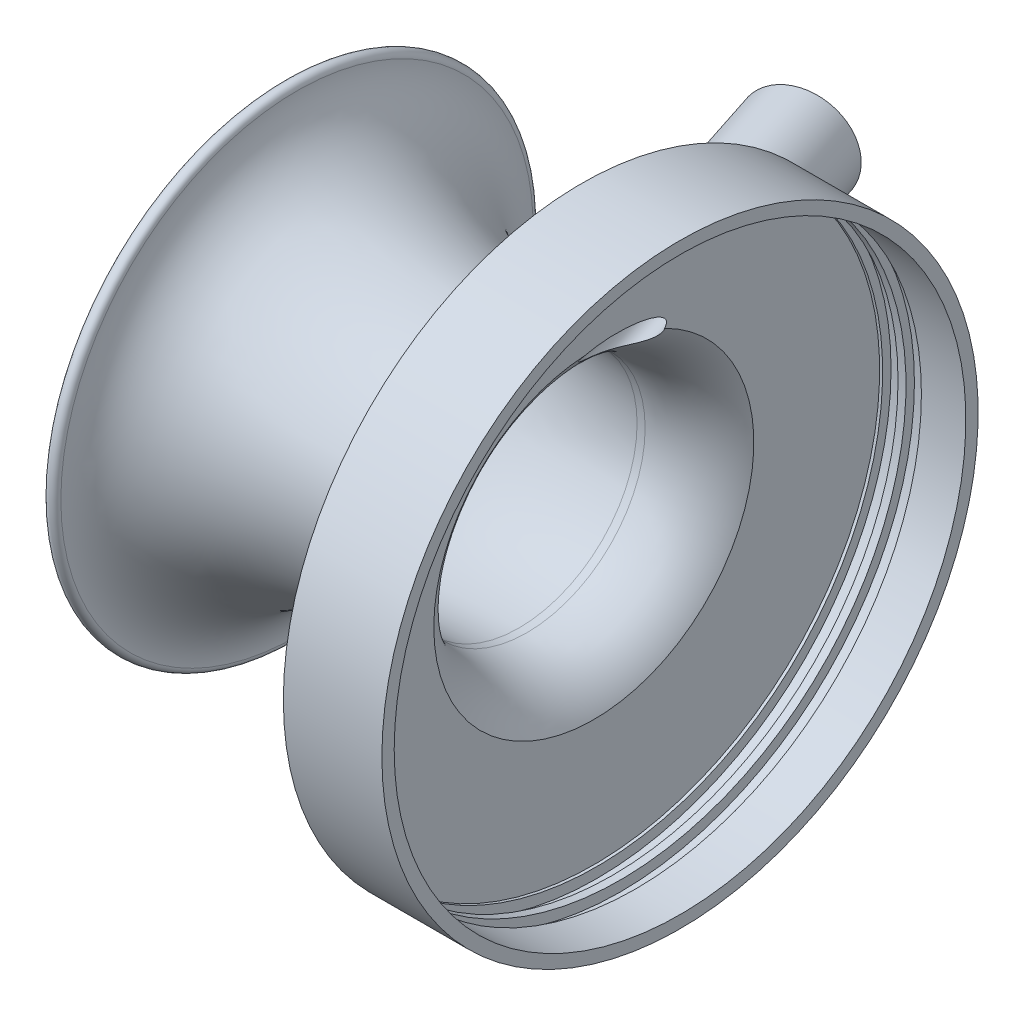
from build123d import *

# Parameters (mm, degrees)
BOSS_EXTRUDE1_REACH      = 139.829
SKETCH2_R                = 5.55625
SKETCH2_R_2              = 3.175
CUT_EXTRUDE1_DEPTH       = 138.828738616
CUT_EXTRUDE1_DEPTH_BACK  = 40.64
SKETCH2_3_R              = 3.175
BOSS_EXTRUDE3_DEPTH      = 25.4
BOSS_EXTRUDE3_DEPTH_BACK = 1.016
SKETCH2_4_R              = 10.16
SKETCH2_4_R_2            = 5.55625
SKETCH5_W                = 3.175
SKETCH5_H                = 2.8575


with BuildPart() as part:
    # Sketch1 → Revolve1 (revolve)
    with BuildSketch(Plane.XY):
        with BuildLine():
            Line((-17.78, 33.403326565), (-17.78, 59.350315565))
            Line((-17.78, 59.350315565), (0, 59.350315565))
            Line((0, 59.350315565), (0, 61.890315565))
            Line((0, 61.890315565), (-20.32, 61.890315565))
            Line((-20.32, 61.890315565), (-20.32, 34.099917601))
            ThreePointArc((-20.32, 34.099917601), (-25.180755406, 29.340296974), (-31.679989745, 27.330101799))
            Line((-31.679989745, 27.330101799), (-33.2365138, 27.301858752))
            add(Edge.make_bspline(
                [(-78.987624158, 49.101480512), (-78.987360194, 48.465111349), (-78.864304013, 47.206846617), (-78.115388687, 44.647319746), (-76.172826927, 41.382782544), (-72.124745626, 37.542839726), (-66.466655311, 34.059492548), (-59.433052835, 31.146010824), (-51.317519817, 28.959245462), (-42.474533701, 27.605945243), (-36.295988449, 27.30132344), (-33.2365138, 27.301858752)],
                knots=[3.141592654, 3.141592654, 3.141592654, 3.141592654, 3.239737699, 3.337882745, 3.534172837, 3.730462929, 3.92675302, 4.123043112, 4.319333204, 4.515623295, 4.711913387, 4.711913387, 4.711913387, 4.711913387], degree=3))
            ThreePointArc((-78.987624158, 49.101480512), (-80.258150841, 50.37095361), (-81.52762394, 49.100426927))
            add(Edge.make_bspline(
                [(-81.52762394, 49.100426927), (-81.51752006, 24.741829023), (-33.213096121, 24.761865565)],
                knots=[0, 0, 0, 1.570796327, 1.570796327, 1.570796327], degree=2, weights=[1, 0.707106781, 1]))
            Line((-33.213096121, 24.761865565), (-31.579850242, 24.791500725))
            ThreePointArc((-31.579850242, 24.791500725), (-23.583053734, 27.339753754), (-17.78, 33.403326565))
        make_face()
    revolve(axis=Axis((-34.322208184, 0.403265565, 0), (1, 0, 0)))


with BuildPart() as body_2:

    # Sketch2 → Boss-Extrude1 (new, up to next)
    with BuildSketch(Plane(origin=(-13.343353817, 0, -41.066620374), x_dir=(0, -1, 0), z_dir=(-0.3090169943749514, 0, -0.9510565162951523)), mode=Mode.PRIVATE) as boss_extrude1_sk1:
        with Locations((-30.889259617, 15.45046582)):
            Circle(SKETCH2_R)
        with Locations((-30.889259617, 15.45046582)):
            Circle(SKETCH2_R_2, mode=Mode.SUBTRACT)
    boss_extrude1_tool1 = extrude(boss_extrude1_sk1.sketch, amount=-BOSS_EXTRUDE1_REACH, mode=Mode.PRIVATE) - part.part
    add(boss_extrude1_tool1.solids().sort_by_distance((-28.03762, 36.288355, -36.292164))[0])


with BuildPart() as part_1:
    add(part.part)

    # Sketch2<3> → Cut-Extrude1 (cut, two sides: drawn at the far end of the back side and taken through both)
    with BuildSketch(Plane(origin=(-13.343353817, 0, -41.066620374), x_dir=(0, -1, 0), z_dir=(-0.3090169943749514, 0, -0.9510565162951523)).offset(-CUT_EXTRUDE1_DEPTH_BACK)):
        with Locations((-30.889259617, 15.45046582)):
            Circle(SKETCH2_3_R)
    extrude(amount=CUT_EXTRUDE1_DEPTH + CUT_EXTRUDE1_DEPTH_BACK, mode=Mode.SUBTRACT)

    add(body_2.part)  # Boss-Extrude3 merges body 2
    # Sketch2<4> → Boss-Extrude3 (add, two sides: drawn at the far end of the back side and taken through both)
    with BuildSketch(Plane(origin=(-13.343353817, 0, -41.066620374), x_dir=(0, -1, 0), z_dir=(-0.3090169943749514, 0, -0.9510565162951523)).offset(-BOSS_EXTRUDE3_DEPTH_BACK)):
        with Locations((-30.889259617, 15.45046582)):
            Circle(SKETCH2_4_R)
        with Locations((-30.889259617, 15.45046582)):
            Circle(SKETCH2_4_R_2, mode=Mode.SUBTRACT)
    extrude(amount=BOSS_EXTRUDE3_DEPTH + BOSS_EXTRUDE3_DEPTH_BACK)

    # Sketch5 → Cut-Revolve2 (revolve, cut)
    with BuildSketch(Plane.XY):
        with Locations((-15.572926281, 59.25506564)):
            Rectangle(SKETCH5_W, SKETCH5_H)
        with Locations((-10.754647864, 59.25506564)):
            Rectangle(SKETCH5_W, SKETCH5_H)
    revolve(axis=Axis((0, 0, 0), (-1, 0, 0)), mode=Mode.SUBTRACT)


solid = part_1.part
